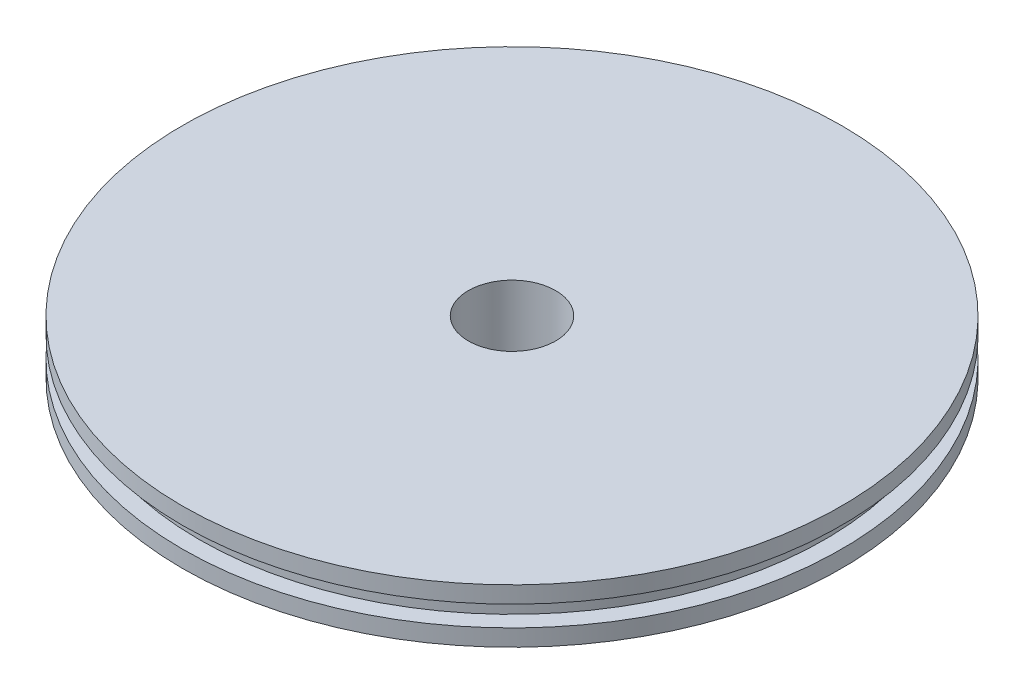
from build123d import *

# Parameters (mm, degrees)
SKETCH6_R                   = 4.1021
F_5_16_CLOSE_FIT_HOLE_DEPTH = 45.063579292
BOSS_EXTRUDE1_START         = 1.016
SKETCH7_R                   = 22.86
SKETCH7_R_2                 = 4.1021
BOSS_EXTRUDE1_DEPTH         = 1.016


with BuildPart() as part:
    # Sketch1 → Revolve1 (revolve)
    with BuildSketch(Plane(origin=(0, 0, 0), x_dir=(0, 0, -1), z_dir=(1, 0, 0))):
        Polygon((0, 0), (0, -5.08), (-30.9499, -5.08), (-30.9499, -3.5052), (-29.3878, -3.5052), (-29.3878, -1.5748), (-30.9499, -1.5748), (-30.9499, 0), align=None)
    revolve(axis=Axis((0, 0, 0), (0, -1, 0)))

    # Sketch6 → 5/16 Close Fit hole (cut, through all)
    with BuildSketch(Plane.XZ.offset(5.08)):
        Circle(SKETCH6_R)
    extrude(amount=-F_5_16_CLOSE_FIT_HOLE_DEPTH, mode=Mode.SUBTRACT)

    # Sketch7 → Boss-Extrude1 (add)
    with BuildSketch(Plane.XZ.offset(5.08).offset(BOSS_EXTRUDE1_START)):
        Circle(SKETCH7_R)
        Circle(SKETCH7_R_2, mode=Mode.SUBTRACT)
    extrude(amount=-BOSS_EXTRUDE1_DEPTH)


solid = part.part
